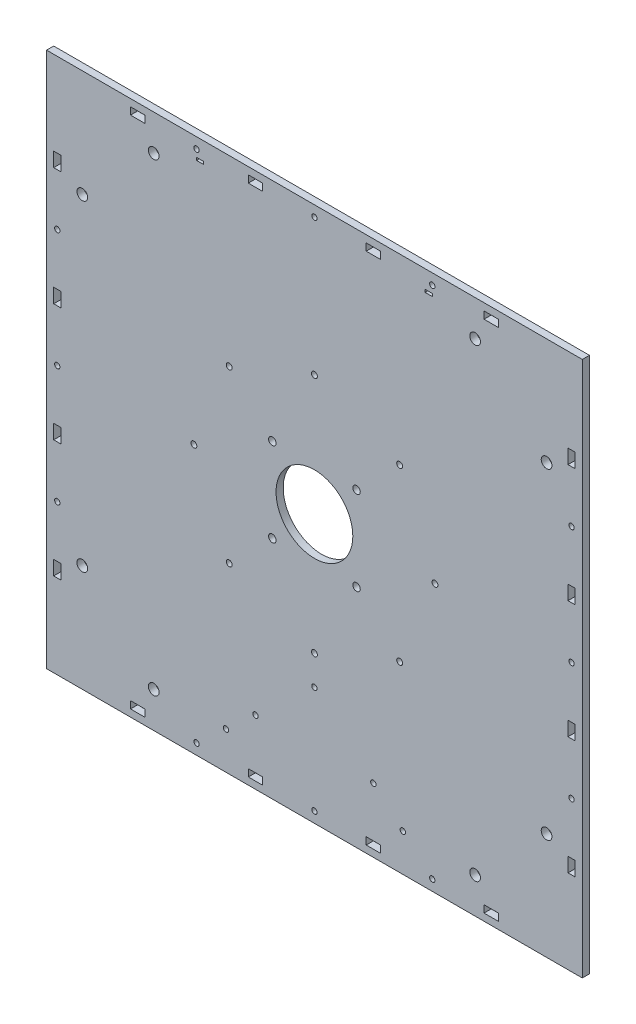
from build123d import *

# Parameters (mm, degrees)
SKETCH_1_R          = 21.5
SKETCH_1_R_2        = 2.1
SKETCH_1_W          = 4
SKETCH_1_H          = 1.5
EXTRUDE_1_DEPTH     = 4
SKETCH_3_R          = 1.5
SKETCH_3_R_2        = 1.65
SKETCH_3_W          = 8.03
SKETCH_3_H          = 4.03
SKETCH_3_W_2        = 4.03
SKETCH_3_H_2        = 8.03
CUT_EXTRUDE_2_DEPTH = 4
SKETCH_7_R          = 3
CUT_EXTRUDE_3_DEPTH = 10


with BuildPart() as part:
    # 草图1 → 凸台-拉伸1 (new body)
    with BuildSketch(Plane.XY):
        Polygon((151.457142857, -41.187142857), (151.457142857, 108.812857143), (-148.542857143, 108.812857143), (-148.542857143, -191.187142857), (151.457142857, -191.187142857), align=None)
        with Locations((1.457142857, -41.187142857)):
            Circle(SKETCH_1_R, mode=Mode.SUBTRACT)
        with Locations((25.027142857, -17.617142857)):
            Circle(SKETCH_1_R_2, mode=Mode.SUBTRACT)
        with Locations((25.027142857, -64.757142857)):
            Circle(SKETCH_1_R_2, mode=Mode.SUBTRACT)
        with Locations((-22.112857143, -64.757142857)):
            Circle(SKETCH_1_R_2, mode=Mode.SUBTRACT)
        with Locations((-22.112857143, -17.617142857)):
            Circle(SKETCH_1_R_2, mode=Mode.SUBTRACT)
        with Locations((65.457142857, 98.062857143)):
            Rectangle(SKETCH_1_W, SKETCH_1_H, mode=Mode.SUBTRACT)
        with Locations((-62.542857143, 98.062857143)):
            Rectangle(SKETCH_1_W, SKETCH_1_H, mode=Mode.SUBTRACT)
    extrude(amount=EXTRUDE_1_DEPTH)

    # 草图3 → 切除-拉伸2 (cut)
    with BuildSketch(Plane.XY.offset(4)):
        with Locations((1.457142857, -185.187142857)):
            Circle(SKETCH_3_R)
        with Locations((67.457142857, -185.187142857)):
            Circle(SKETCH_3_R)
        with Locations((-64.542857143, -185.187142857)):
            Circle(SKETCH_3_R)
        with Locations((-142.542857143, 24.812857143)):
            Circle(SKETCH_3_R)
        with Locations((-142.542857143, -41.187142857)):
            Circle(SKETCH_3_R)
        with Locations((-142.542857143, -107.187142857)):
            Circle(SKETCH_3_R)
        with Locations((67.457142857, 102.812857143)):
            Circle(SKETCH_3_R)
        with Locations((1.457142857, 102.812857143)):
            Circle(SKETCH_3_R)
        with Locations((-64.542857143, 102.812857143)):
            Circle(SKETCH_3_R)
        with Locations((145.457142857, -107.187142857)):
            Circle(SKETCH_3_R)
        with Locations((145.457142857, -41.187142857)):
            Circle(SKETCH_3_R)
        with Locations((145.457142857, 24.812857143)):
            Circle(SKETCH_3_R)
        with Locations((50.957142857, -170.187142857)):
            Circle(SKETCH_3_R)
        with Locations((-48.042857143, -170.187142857)):
            Circle(SKETCH_3_R)
        with Locations((-31.542857143, -155.187142857)):
            Circle(SKETCH_3_R)
        with Locations((34.457142857, -155.187142857)):
            Circle(SKETCH_3_R)
        with Locations((1.457142857, -108.687142857)):
            Circle(SKETCH_3_R_2)
        with Locations((-46.272564873, -88.916850587)):
            Circle(SKETCH_3_R_2)
        with Locations((-66.042857143, -41.187142857)):
            Circle(SKETCH_3_R_2)
        with Locations((-46.272564873, 6.542564873)):
            Circle(SKETCH_3_R_2)
        with Locations((1.457142857, 26.312857143)):
            Circle(SKETCH_3_R_2)
        with Locations((49.186850587, 6.542564873)):
            Circle(SKETCH_3_R_2)
        with Locations((68.957142857, -41.187142857)):
            Circle(SKETCH_3_R_2)
        with Locations((49.186850587, -88.916850587)):
            Circle(SKETCH_3_R_2)
        with Locations((1.457142857, -125.187142857)):
            Circle(SKETCH_3_R)
        with Locations((100.457142857, -185.187142857)):
            Rectangle(SKETCH_3_W, SKETCH_3_H)
        with Locations((34.457142857, -185.187142857)):
            Rectangle(SKETCH_3_W, SKETCH_3_H)
        with Locations((-31.542857143, -185.187142857)):
            Rectangle(SKETCH_3_W, SKETCH_3_H)
        with Locations((-97.542857143, -185.187142857)):
            Rectangle(SKETCH_3_W, SKETCH_3_H)
        with Locations((-142.542857143, 57.812857143)):
            Rectangle(SKETCH_3_W_2, SKETCH_3_H_2)
        with Locations((-142.542857143, -8.187142857)):
            Rectangle(SKETCH_3_W_2, SKETCH_3_H_2)
        with Locations((-142.542857143, -74.187142857)):
            Rectangle(SKETCH_3_W_2, SKETCH_3_H_2)
        with Locations((-142.542857143, -140.187142857)):
            Rectangle(SKETCH_3_W_2, SKETCH_3_H_2)
        with Locations((100.457142857, 102.812857143)):
            Rectangle(SKETCH_3_W, SKETCH_3_H)
        with Locations((34.457142857, 102.812857143)):
            Rectangle(SKETCH_3_W, SKETCH_3_H)
        with Locations((-31.542857143, 102.812857143)):
            Rectangle(SKETCH_3_W, SKETCH_3_H)
        with Locations((-97.542857143, 102.812857143)):
            Rectangle(SKETCH_3_W, SKETCH_3_H)
        with Locations((145.457142857, -140.187142857)):
            Rectangle(SKETCH_3_W_2, SKETCH_3_H_2)
        with Locations((145.457142857, -74.187142857)):
            Rectangle(SKETCH_3_W_2, SKETCH_3_H_2)
        with Locations((145.457142857, -8.187142857)):
            Rectangle(SKETCH_3_W_2, SKETCH_3_H_2)
        with Locations((145.457142857, 57.812857143)):
            Rectangle(SKETCH_3_W_2, SKETCH_3_H_2)
    extrude(amount=-CUT_EXTRUDE_2_DEPTH, mode=Mode.SUBTRACT)

    # 草图7 → 切除-拉伸3 (cut)
    with BuildSketch(Plane.XY.offset(4)):
        with Locations((-88.542857143, -171.187142857)):
            Circle(SKETCH_7_R)
        with Locations((91.457142857, -171.187142857)):
            Circle(SKETCH_7_R)
        with Locations((-128.542857143, 48.812857143)):
            Circle(SKETCH_7_R)
        with Locations((-128.542857143, -131.187142857)):
            Circle(SKETCH_7_R)
        with Locations((91.457142857, 88.812857143)):
            Circle(SKETCH_7_R)
        with Locations((-88.542857143, 88.812857143)):
            Circle(SKETCH_7_R)
        with Locations((131.457142857, -131.187142857)):
            Circle(SKETCH_7_R)
        with Locations((131.457142857, 48.812857143)):
            Circle(SKETCH_7_R)
    extrude(amount=-CUT_EXTRUDE_3_DEPTH, mode=Mode.SUBTRACT)


solid = part.part
